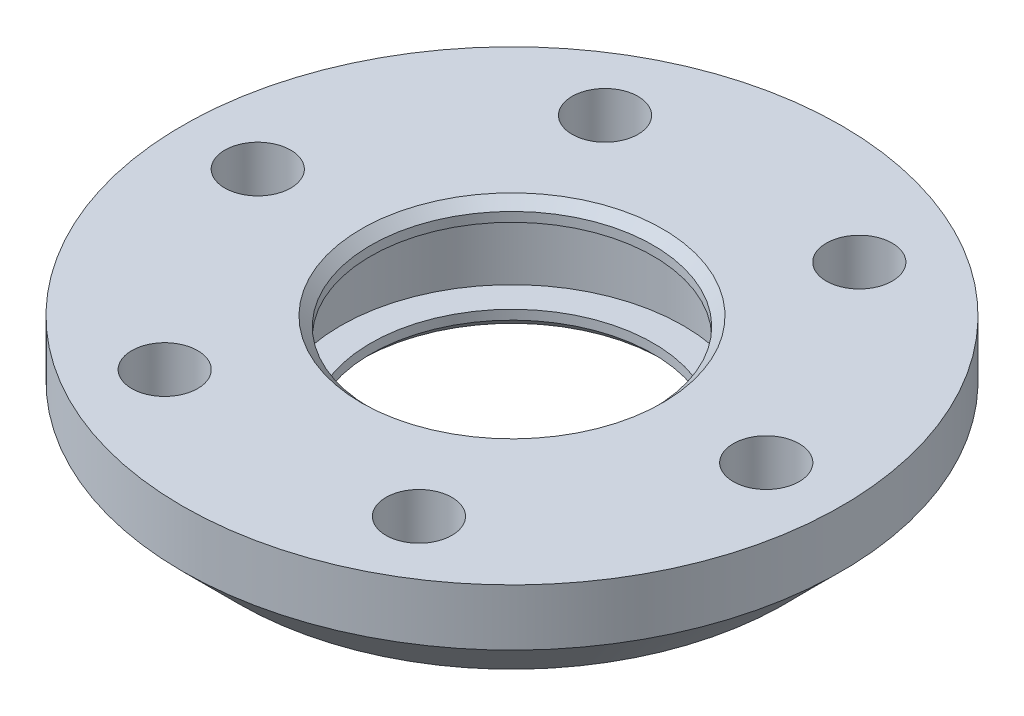
from build123d import *

# Parameters (mm, degrees)
SKETCH1_R           = 17.5
SKETCH1_R_2         = 1.75
SKETCH1_R_3         = 7.5
BOSS_EXTRUDE1_DEPTH = 3
SKETCH2_R           = 9.1
CUT_EXTRUDE1_DEPTH  = 2
SKETCH3_R           = 15.25
SKETCH3_R_2         = 11.75
BOSS_EXTRUDE2_DEPTH = 1.5
CHAMFER1_SIZE       = 0.5
CHAMFER2_SIZE       = 3


with BuildPart() as part:
    # Sketch1 → Boss-Extrude1 (new, symmetric)
    with BuildSketch(Plane(origin=(0, 0, 0), x_dir=(1, 0, 0), z_dir=(0, 1, 0))):
        Circle(SKETCH1_R)
        with Locations((13.5, 0)):
            Circle(SKETCH1_R_2, mode=Mode.SUBTRACT)
        with Locations((6.75, -11.691342951)):
            Circle(SKETCH1_R_2, mode=Mode.SUBTRACT)
        with Locations((-6.75, -11.691342951)):
            Circle(SKETCH1_R_2, mode=Mode.SUBTRACT)
        with Locations((-13.5, 0)):
            Circle(SKETCH1_R_2, mode=Mode.SUBTRACT)
        with Locations((-6.75, 11.691342951)):
            Circle(SKETCH1_R_2, mode=Mode.SUBTRACT)
        with Locations((6.75, 11.691342951)):
            Circle(SKETCH1_R_2, mode=Mode.SUBTRACT)
        Circle(SKETCH1_R_3, mode=Mode.SUBTRACT)
    extrude(amount=BOSS_EXTRUDE1_DEPTH, both=True)

    # Sketch2 → Cut-Extrude1 (cut, symmetric)
    with BuildSketch(Plane(origin=(0, 0, 0), x_dir=(1, 0, 0), z_dir=(0, 1, 0))):
        Circle(SKETCH2_R)
    extrude(amount=CUT_EXTRUDE1_DEPTH, both=True, mode=Mode.SUBTRACT)

    # Sketch3 → Boss-Extrude2 (add)
    with BuildSketch(Plane.XZ.offset(3)):
        Circle(SKETCH3_R)
        Circle(SKETCH3_R_2, mode=Mode.SUBTRACT)
    extrude(amount=-BOSS_EXTRUDE2_DEPTH)

    # Chamfer1
    chamfer1_edges = [part.edges().sort_by_distance(p)[0] for p in [
        (-7.5, -3, 0),
        (-7.5, 3, 0),
    ]]
    chamfer(chamfer1_edges, length=CHAMFER1_SIZE)

    # Chamfer2
    chamfer2_edges = [part.edges().sort_by_distance(p)[0] for p in [
        (-17.5, -3, 0),
    ]]
    chamfer(chamfer2_edges, length=CHAMFER2_SIZE)


solid = part.part
